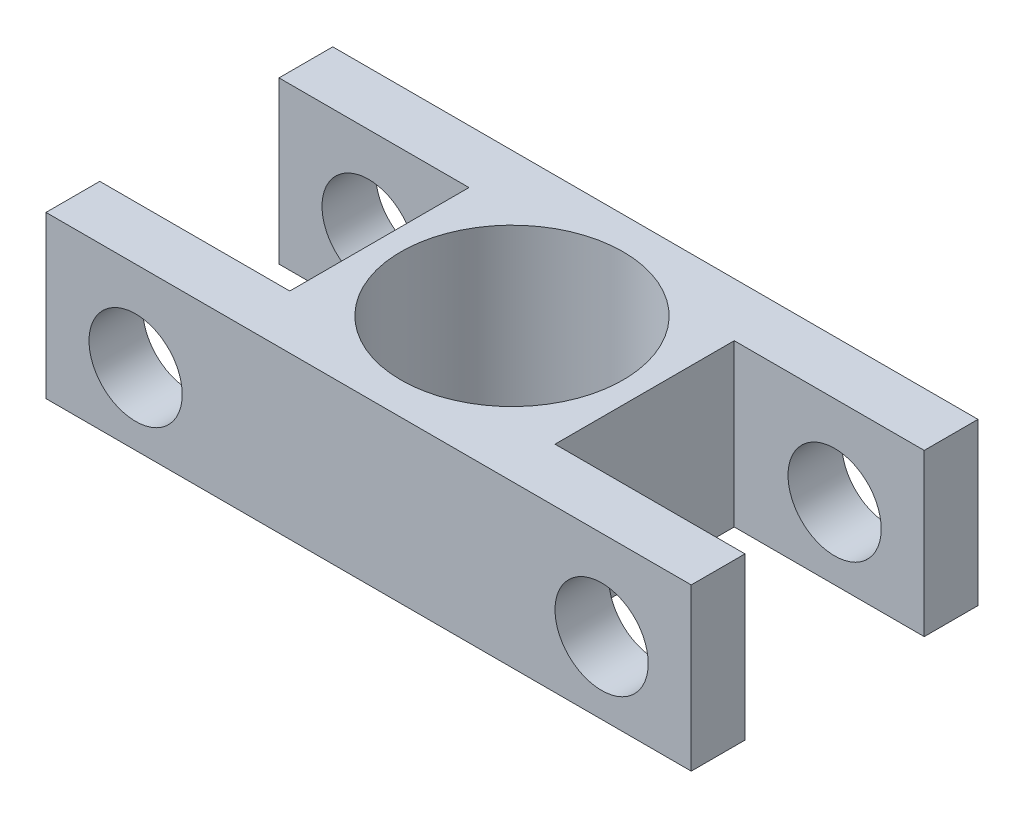
from build123d import *

# Parameters (mm, degrees)
SKETCH_1_W              = 36
SKETCH_1_H              = 9
BLOCKEXTRUDE_DEPTH      = 16
SKETCH_3_W              = 12.6
SKETCH_3_H              = 13
CLEVIS_SLOT_DEPTH       = 5
SKETCH_4_W              = 12.6
SKETCH_4_H              = 13
CUT_EXTRUDE_2_DEPTH     = 5
SKETCH_5_R              = 2.6
PIVOT_BORE_DEPTH        = 41.410394702
SKETCH_6_R              = 2.6
CUT_EXTRUDE_4_DEPTH     = 41.410394702
SKETCH_7_R              = 6.2
SPINDLE_CLEARANCE_DEPTH = 41.410394702


with BuildPart() as part:
    # 草图1 → BlockExtrude (new body)
    with BuildSketch(Plane.XY):
        with Locations((18, 4.5)):
            Rectangle(SKETCH_1_W, SKETCH_1_H)
    extrude(amount=BLOCKEXTRUDE_DEPTH)

    # 草图3 → Clevis_slot (cut, symmetric)
    with BuildSketch(Plane.XY.offset(8)):
        with Locations((4.3, 4.5)):
            Rectangle(SKETCH_3_W, SKETCH_3_H)
    extrude(amount=CLEVIS_SLOT_DEPTH, both=True, mode=Mode.SUBTRACT)

    # 草图4 → 切除-拉伸2 (cut, symmetric)
    with BuildSketch(Plane.XY.offset(8)):
        with Locations((31.7, 4.5)):
            Rectangle(SKETCH_4_W, SKETCH_4_H)
    extrude(amount=CUT_EXTRUDE_2_DEPTH, both=True, mode=Mode.SUBTRACT)

    # 草图5 → Pivot_bore (cut, through all)
    with BuildSketch(Plane.XY.offset(16)):
        with Locations((5, 4)):
            Circle(SKETCH_5_R)
    extrude(amount=-PIVOT_BORE_DEPTH, mode=Mode.SUBTRACT)

    # 草图6 → 切除-拉伸4 (cut, through all)
    with BuildSketch(Plane.XY.offset(16)):
        with Locations((31, 4)):
            Circle(SKETCH_6_R)
    extrude(amount=-CUT_EXTRUDE_4_DEPTH, mode=Mode.SUBTRACT)

    # 草图7 → Spindle_clearance (cut, through all)
    with BuildSketch(Plane(origin=(0, 9, 0), x_dir=(1, 0, 0), z_dir=(0, 1, 0))):
        with Locations((18, -8)):
            Circle(SKETCH_7_R)
    extrude(amount=-SPINDLE_CLEARANCE_DEPTH, mode=Mode.SUBTRACT)


solid = part.part
